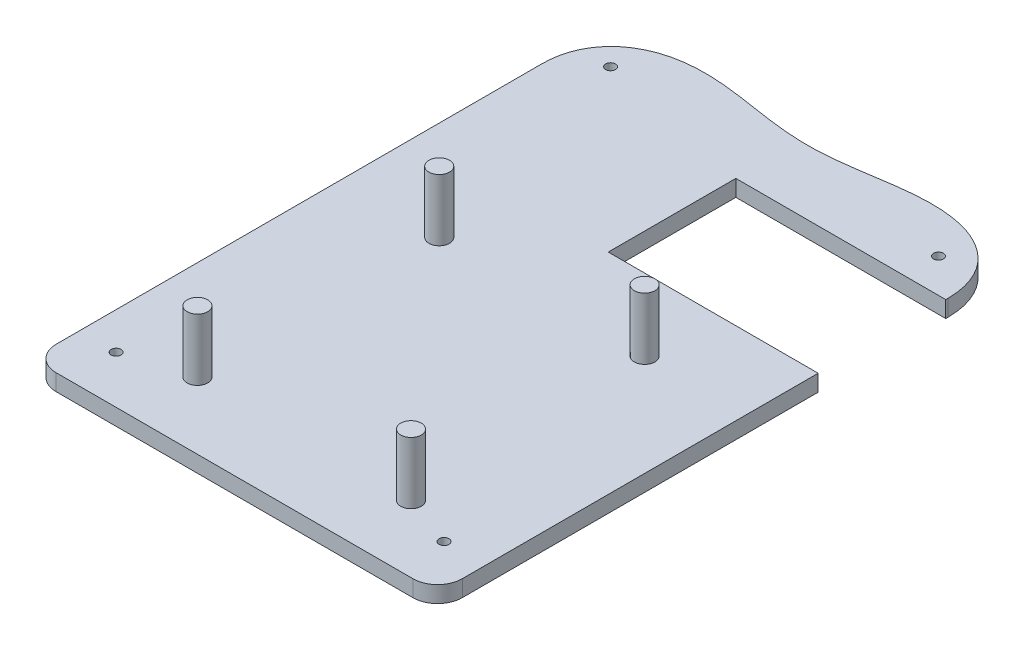
from build123d import *

# Parameters (mm, degrees)
BOSS_EXTRUDE1_DEPTH                             = 4
SKETCH2_R                                       = 2.5
BOSS_EXTRUDE2_DEPTH                             = 15
SKETCH3_W                                       = 51
SKETCH3_H                                       = 31
CUT_EXTRUDE1_DEPTH                              = 15
CSK_FOR_M2_FLAT_HEAD_MACHINE_SCREW1_D           = 2.4
CSK_FOR_M2_FLAT_HEAD_MACHINE_SCREW1_DEPTH       = 58
CSK_FOR_M2_FLAT_HEAD_MACHINE_SCREW1_CSINK_D     = 4.4
CSK_FOR_M2_FLAT_HEAD_MACHINE_SCREW1_CSINK_ANGLE = 90
CSK_FOR_M2_FLAT_HEAD_MACHINE_SCREW1_TIP         = 0.721032743


# Read off the part's stored shape, not the designer's step: Boss-Extrude1
with BuildPart() as part:
    # Boss-Extrude1 outline → Boss-Extrude1 (new body)
    with BuildSketch(Plane(origin=(0, 0, 0), x_dir=(1, 0, 0), z_dir=(0, 1, 0))):
        with BuildLine():
            ThreePointArc((100.769776489, 8.232980914), (105.012417176, 9.990340227), (106.769776489, 14.232980914))
            Line((106.769776489, 14.232980914), (106.769776489, 132.22554715))
            add(Edge.make_bspline(
                [(106.769776489, 132.22554715), (106.769776489, 159.234690285), (66.769776489, 155.557917259), (71.369776489, 140.524437357), (43.491097907, 140.524437357), (48.091097907, 155.557917259), (8.091097907, 159.234690285), (8.091097907, 132.236386798)],
                knots=[0, 0, 0, 0, 0, 0, 0, 0, 1, 1, 1, 1, 1, 1, 1, 1], degree=7))
            Line((8.091097907, 132.236386798), (8.091097907, 14.232980914))
            ThreePointArc((8.091097907, 14.232980914), (9.84845722, 9.990340227), (14.091097907, 8.232980914))
            Line((14.091097907, 8.232980914), (100.769776489, 8.232980914))
        make_face()
    extrude(amount=BOSS_EXTRUDE1_DEPTH)

    # Sketch2 → Boss-Extrude2 (add)
    with BuildSketch(Plane(origin=(0, 4, 0), x_dir=(1, 0, 0), z_dir=(0, 1, 0))):
        with Locations(Location((32.161972906, 83.24092865, 0), (0, 0, 270))):
            Circle(SKETCH2_R)
        with Locations(Location((82.067189883, 83.24092865, 0), (0, 0, 270))):
            Circle(SKETCH2_R)
        with Locations(Location((32.161972906, 24.49174917, 0), (0, 0, 270))):
            Circle(SKETCH2_R)
        with Locations(Location((84.053708344, 24.49174917, 0), (0, 0, 270))):
            Circle(SKETCH2_R)
    extrude(amount=BOSS_EXTRUDE2_DEPTH)

    # Sketch3 → Cut-Extrude1 (cut)
    with BuildSketch(Plane(origin=(0, 4, 0), x_dir=(1, 0, 0), z_dir=(0, 1, 0))):
        with Locations((81.269776489, 116.201924425)):
            Rectangle(SKETCH3_W, SKETCH3_H)
    extrude(amount=-CUT_EXTRUDE1_DEPTH, mode=Mode.SUBTRACT)

    # CSK for M2 Flat Head Machine Screw1
    with Locations(Plane(origin=(17.058706918, 0, -139.962329176), x_dir=(0, 0, -1), z_dir=(0, -1, 0))):
        with Locations((0, 0), (0, 79.68146648), (-120.125549754, 0), (-120.125549754, 79.68146648)):
            CounterSinkHole(CSK_FOR_M2_FLAT_HEAD_MACHINE_SCREW1_D / 2, CSK_FOR_M2_FLAT_HEAD_MACHINE_SCREW1_CSINK_D / 2, depth=CSK_FOR_M2_FLAT_HEAD_MACHINE_SCREW1_DEPTH, counter_sink_angle=CSK_FOR_M2_FLAT_HEAD_MACHINE_SCREW1_CSINK_ANGLE)
            with Locations((0, 0, -(CSK_FOR_M2_FLAT_HEAD_MACHINE_SCREW1_DEPTH + CSK_FOR_M2_FLAT_HEAD_MACHINE_SCREW1_TIP / 2))):  # 118° drill point
                Cone(0, CSK_FOR_M2_FLAT_HEAD_MACHINE_SCREW1_D / 2, CSK_FOR_M2_FLAT_HEAD_MACHINE_SCREW1_TIP, mode=Mode.SUBTRACT)


solid = part.part
